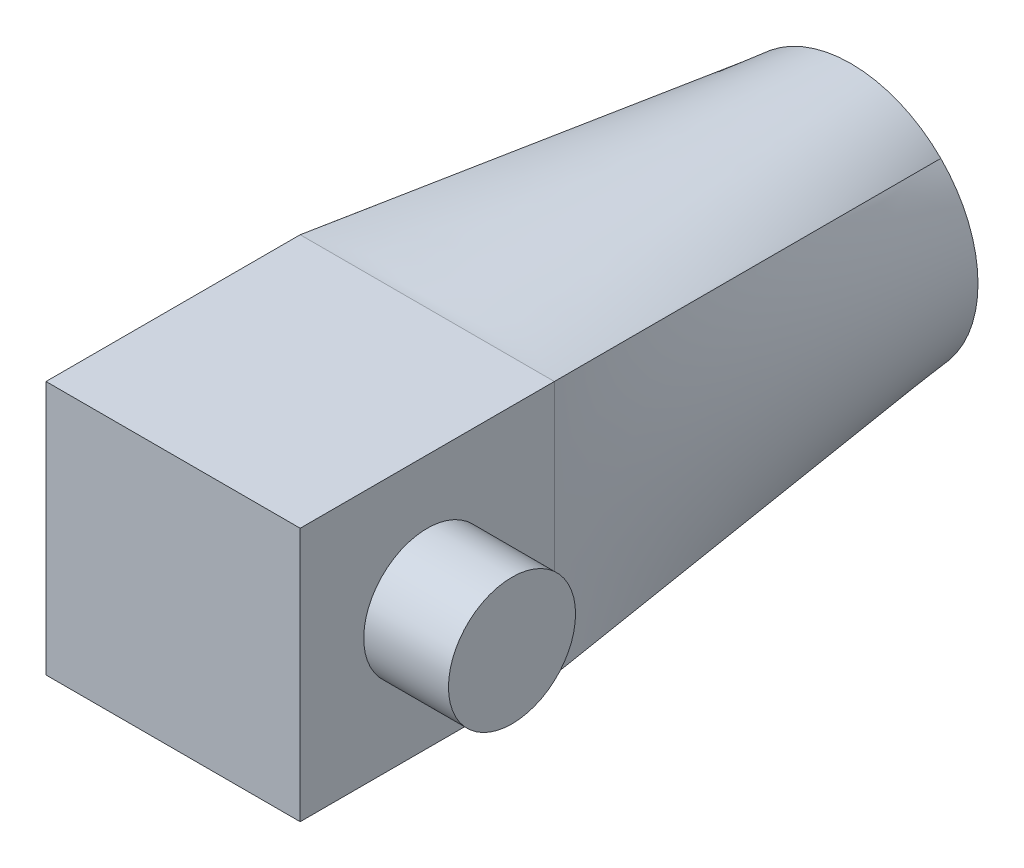
from build123d import *

# Parameters (mm, degrees)
SKETCH1_8_R         = 0.75
CUT_EXTRUDE3_DEPTH  = 3
SKETCH3_2_W         = 3
SKETCH3_2_H         = 3
BOSS_EXTRUDE3_DEPTH = 3
SKETCH5_R           = 0.75
BOSS_EXTRUDE4_DEPTH = 1


with BuildPart() as part:
    # Loft2: read off the stored shape, not the designer's step
    # Loft2: loft between two sections, ruled curve by curve
    loft2_from = [
        Edge.make_bspline([(1.060660172, -1.060660172, 0), (1.185660172, -0.935660172, 0), (1.297737894, -0.778019164, 0), (1.45548774, -0.413512879, 0), (1.5, -0.207106781, 0), (1.5, 0.207106781, 0), (1.45548774, 0.413512879, 0), (1.297737894, 0.778019164, 0), (1.185660172, 0.935660172, 0), (1.060660172, 1.060660172, 0)], [0, 0, 0, 0, 0.25, 0.25, 0.5, 0.5, 0.75, 0.75, 1, 1, 1, 1], 3),
        Edge.make_bspline([(1.060660172, 1.060660172, 0), (0.935660172, 1.185660172, 0), (0.778019164, 1.297737894, 0), (0.413512879, 1.45548774, 0), (0.207106781, 1.5, 0), (-0.207106781, 1.5, 0), (-0.413512879, 1.45548774, 0), (-0.778019164, 1.297737894, 0), (-0.935660172, 1.185660172, 0), (-1.060660172, 1.060660172, 0)], [0, 0, 0, 0, 0.25, 0.25, 0.5, 0.5, 0.75, 0.75, 1, 1, 1, 1], 3),
        Edge.make_bspline([(-1.060660172, -1.060660172, 0), (-0.935660172, -1.185660172, 0), (-0.778019164, -1.297737894, 0), (-0.413512879, -1.45548774, 0), (-0.207106781, -1.5, 0), (0.207106781, -1.5, 0), (0.413512879, -1.45548774, 0), (0.778019164, -1.297737894, 0), (0.935660172, -1.185660172, 0), (1.060660172, -1.060660172, 0)], [0, 0, 0, 0, 0.25, 0.25, 0.5, 0.5, 0.75, 0.75, 1, 1, 1, 1], 3),
        Edge.make_bspline([(-1.060660172, 1.060660172, 0), (-1.185660172, 0.935660172, 0), (-1.297737894, 0.778019164, 0), (-1.45548774, 0.413512879, 0), (-1.5, 0.207106781, 0), (-1.5, -0.207106781, 0), (-1.45548774, -0.413512879, 0), (-1.297737894, -0.778019164, 0), (-1.185660172, -0.935660172, 0), (-1.060660172, -1.060660172, 0)], [0, 0, 0, 0, 0.25, 0.25, 0.5, 0.5, 0.75, 0.75, 1, 1, 1, 1], 3),
    ]
    loft2_to = [
        Edge.make_bspline([(1.5, -1.5, 5), (1.5, -1.25, 5), (1.5, -1, 5), (1.5, -0.5, 5), (1.5, -0.25, 5), (1.5, 0.25, 5), (1.5, 0.5, 5), (1.5, 1, 5), (1.5, 1.25, 5), (1.5, 1.5, 5)], [0, 0, 0, 0, 0.25, 0.25, 0.5, 0.5, 0.75, 0.75, 1, 1, 1, 1], 3),
        Edge.make_bspline([(1.5, 1.5, 5), (1.25, 1.5, 5), (1, 1.5, 5), (0.5, 1.5, 5), (0.25, 1.5, 5), (-0.25, 1.5, 5), (-0.5, 1.5, 5), (-1, 1.5, 5), (-1.25, 1.5, 5), (-1.5, 1.5, 5)], [0, 0, 0, 0, 0.25, 0.25, 0.5, 0.5, 0.75, 0.75, 1, 1, 1, 1], 3),
        Edge.make_bspline([(-1.5, -1.5, 5), (-1.25, -1.5, 5), (-1, -1.5, 5), (-0.5, -1.5, 5), (-0.25, -1.5, 5), (0.25, -1.5, 5), (0.5, -1.5, 5), (1, -1.5, 5), (1.25, -1.5, 5), (1.5, -1.5, 5)], [0, 0, 0, 0, 0.25, 0.25, 0.5, 0.5, 0.75, 0.75, 1, 1, 1, 1], 3),
        Edge.make_bspline([(-1.5, 1.5, 5), (-1.5, 1.25, 5), (-1.5, 1, 5), (-1.5, 0.5, 5), (-1.5, 0.25, 5), (-1.5, -0.25, 5), (-1.5, -0.5, 5), (-1.5, -1, 5), (-1.5, -1.25, 5), (-1.5, -1.5, 5)], [0, 0, 0, 0, 0.25, 0.25, 0.5, 0.5, 0.75, 0.75, 1, 1, 1, 1], 3),
    ]
    loft2 = Solid(Shell([*[Face.make_surface_from_curves(loft2_from[k], loft2_to[k]) for k in range(4)], Face(Wire(loft2_from)), Face(Wire(loft2_to))]))
    add(loft2)

    # Sketch1<8> → Cut-Extrude3 (cut)
    with BuildSketch(Plane.XY):
        Circle(SKETCH1_8_R)
    extrude(amount=CUT_EXTRUDE3_DEPTH, mode=Mode.SUBTRACT)

    # Sketch3<2> → Boss-Extrude3 (add)
    with BuildSketch(Plane.XY.offset(5)):
        Rectangle(SKETCH3_2_W, SKETCH3_2_H)
    extrude(amount=BOSS_EXTRUDE3_DEPTH)

    # Sketch5 → Boss-Extrude4 (add)
    with BuildSketch(Plane(origin=(1.5, 0, 0), x_dir=(0, 0, -1), z_dir=(1, 0, 0))):
        with Locations(Location((-6.5, 0, 0), (0, 0, 270))):
            Circle(SKETCH5_R)
    extrude(amount=BOSS_EXTRUDE4_DEPTH)


solid = part.part
